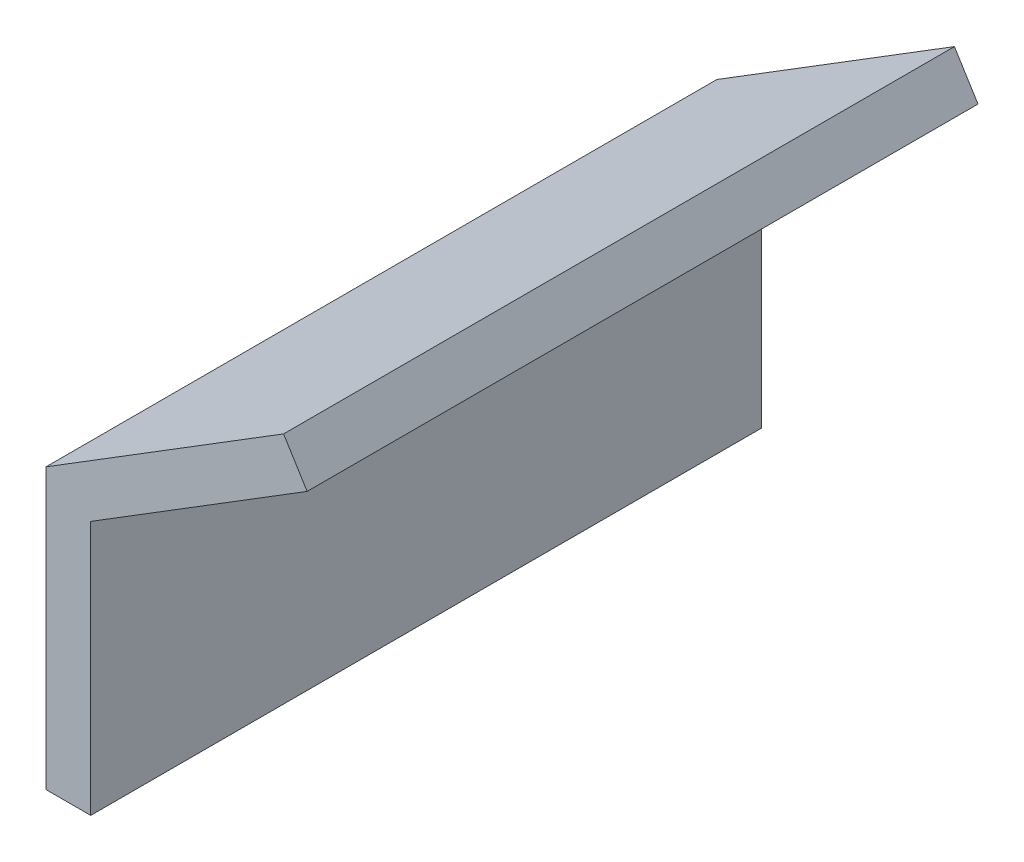
from build123d import *

# Parameters (mm, degrees)
BOSS_EXTRUDE1_DEPTH = 60


with BuildPart() as part:
    # Sketch1 → Boss-Extrude1 (new, symmetric)
    with BuildSketch(Plane.XY):
        Polygon((0, 0), (42.494634649, 26.347789775), (46.710281013, 19.548648231), (8, -4.452742878), (8, -50), (0, -50), align=None)
    extrude(amount=BOSS_EXTRUDE1_DEPTH, both=True)


solid = part.part
